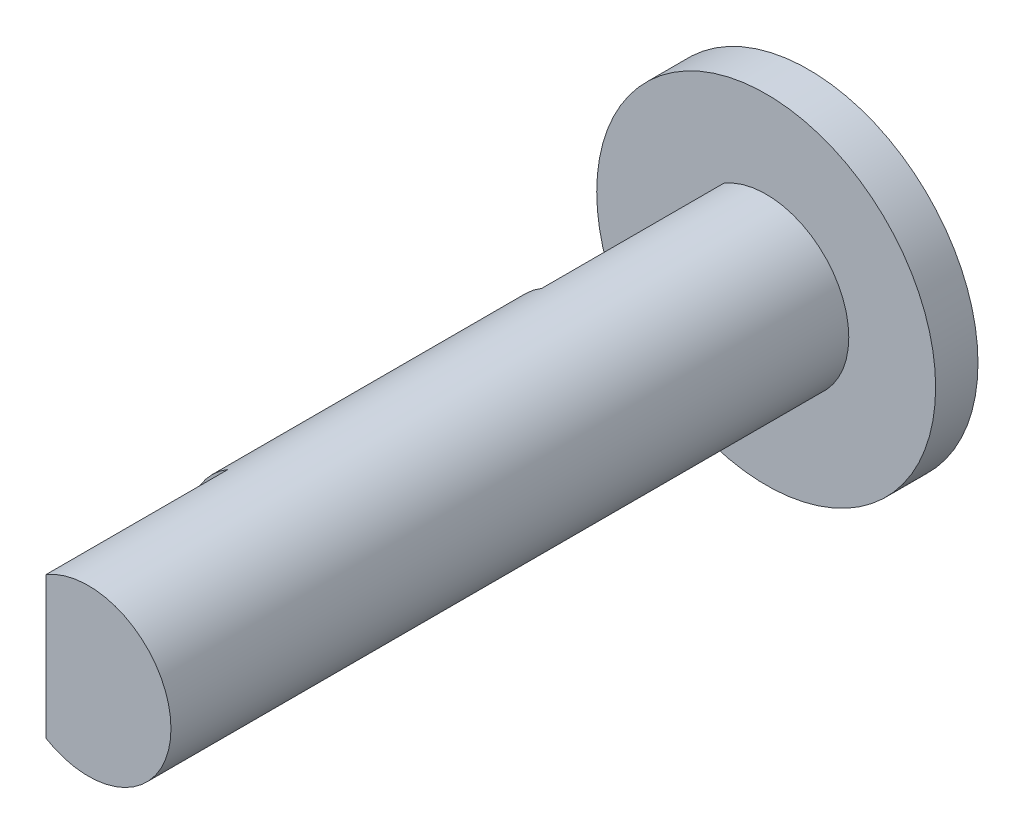
from build123d import *

# Parameters (mm, degrees)
SKETCH2_R           = 1.95
BOSS_EXTRUDE1_DEPTH = 8
CUT_EXTRUDE1_START  = -4.3
CUT_EXTRUDE1_DEPTH  = 4.3
SKETCH5_R           = 4
BOSS_EXTRUDE2_DEPTH = 1


with BuildPart() as part:
    # Sketch2 → Boss-Extrude1 (new, symmetric)
    with BuildSketch(Plane.XY):
        Circle(SKETCH2_R)
    extrude(amount=BOSS_EXTRUDE1_DEPTH, both=True)

    # Sketch4 → Cut-Extrude1 (cut)
    with BuildSketch(Plane(origin=(0, 0, -8), x_dir=(-1, 0, 0), z_dir=(0, 0, -1)).offset(CUT_EXTRUDE1_START)):
        with BuildLine():
            Line((1, 1.674066904), (1, -1.674066904))
            ThreePointArc((1, -1.674066904), (1.95, 0), (1, 1.674066904))
        make_face()
    cut_extrude1 = extrude(amount=CUT_EXTRUDE1_DEPTH, mode=Mode.SUBTRACT)

    # Mirror1: Cut-Extrude1 across plane
    add(cut_extrude1.mirror(Plane.XY), mode=Mode.SUBTRACT)

    # Sketch5 → Boss-Extrude2 (add)
    with BuildSketch(Plane(origin=(0, 0, -8), x_dir=(-1, 0, 0), z_dir=(0, 0, -1))):
        Circle(SKETCH5_R)
    extrude(amount=BOSS_EXTRUDE2_DEPTH)


solid = part.part
